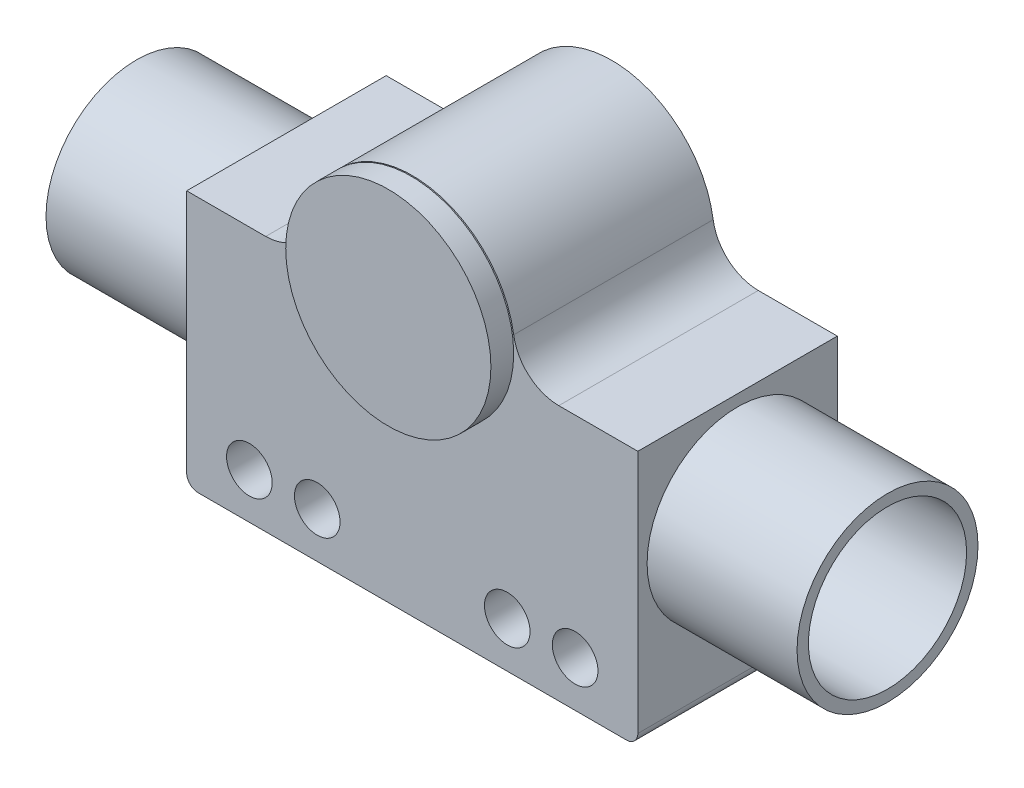
from build123d import *

# Parameters (mm, degrees)
SKETCH2_R               = 15.875
SKETCH2_R_2             = 13.875
BOSS_EXTRUDE1_DEPTH     = 65.88125
SKETCH3_R               = 4
BOSS_EXTRUDE2_DEPTH     = 17.5
CUT_EXTRUDE1_DEPTH      = 80.035366144
CUT_EXTRUDE1_DEPTH_BACK = 80.035366144
SKETCH2_3_R             = 13.875
CUT_EXTRUDE2_DEPTH      = 80.035366144
CUT_EXTRUDE2_DEPTH_BACK = 80.035366144
SKETCH3_3_R             = 4
FILLET1_R               = 2
BOSS_EXTRUDE3_START     = 0.2
SKETCH4_R               = 18
BOSS_EXTRUDE3_DEPTH     = 4
SKETCH5_R               = 7.9375
BOSS_EXTRUDE4_DEPTH     = 40
CHAMFER1_SIZE           = 1
CUT_EXTRUDE3_START      = -25
CUT_EXTRUDE3_DEPTH      = 25
SKETCH8_R               = 10
CUT_EXTRUDE4_DEPTH      = 34


# Read off the part's stored shape, not the designer's step: Split1
with BuildPart() as part:
    # Sketch2 → Boss-Extrude1 (new, symmetric)
    # profile 1 of 2: a face of its own
    with BuildSketch(Plane(origin=(0, 0, 0), x_dir=(0, 0, -1), z_dir=(1, 0, 0))):
        Circle(SKETCH2_R)
        Circle(SKETCH2_R_2, mode=Mode.SUBTRACT)
    # profile 2 of 2: a face of its own
    with BuildSketch(Plane(origin=(0, 0, 0), x_dir=(0, 0, -1), z_dir=(1, 0, 0))):
        Circle(SKETCH2_R_2)
    extrude(amount=BOSS_EXTRUDE1_DEPTH, both=True)

    # Sketch3 → Boss-Extrude2 (add, symmetric)
    # profile 1 of 6: a face of its own
    with BuildSketch(Plane.XY):
        with BuildLine():
            Line((0, -27), (0, 40))
            ThreePointArc((0, 40), (-11.74119965, 35.643468429), (-17.798965194, 24.682692308))
            ThreePointArc((-17.798965194, 24.682692308), (-20.491305436, 19.811236254), (-25.709616392, 17.875))
            Line((-25.709616392, 17.875), (-39.575, 17.875))
            Line((-39.575, 17.875), (-39.575, -27))
            Line((-39.575, -27), (0, -27))
        make_face()
        with Locations((-28.575, -19)):
            Circle(SKETCH3_R, mode=Mode.SUBTRACT)
        with Locations((-16.66875, -19)):
            Circle(SKETCH3_R, mode=Mode.SUBTRACT)
    # profile 2 of 6: a face of its own
    with BuildSketch(Plane.XY):
        with Locations((-28.575, -19)):
            Circle(SKETCH3_R)
    # profile 3 of 6: a face of its own
    with BuildSketch(Plane.XY):
        with Locations((-16.66875, -19)):
            Circle(SKETCH3_R)
    # profile 4 of 6: a face of its own
    with BuildSketch(Plane.XY):
        with BuildLine():
            ThreePointArc((17.798965194, 24.682692308), (11.74119965, 35.643468429), (0, 40))
            Line((0, 40), (0, -27))
            Line((0, -27), (39.575, -27))
            Line((39.575, -27), (39.575, 17.875))
            Line((39.575, 17.875), (25.709616392, 17.875))
            ThreePointArc((25.709616392, 17.875), (20.491305436, 19.811236254), (17.798965194, 24.682692308))
        make_face()
        with Locations((16.66875, -19)):
            Circle(SKETCH3_R, mode=Mode.SUBTRACT)
        with Locations((28.575, -19)):
            Circle(SKETCH3_R, mode=Mode.SUBTRACT)
    # profile 5 of 6: a face of its own
    with BuildSketch(Plane.XY):
        with Locations((28.575, -19)):
            Circle(SKETCH3_R)
    # profile 6 of 6: a face of its own
    with BuildSketch(Plane.XY):
        with Locations((16.66875, -19)):
            Circle(SKETCH3_R)
    extrude(amount=BOSS_EXTRUDE2_DEPTH, both=True)

    # Sketch2<3> → Cut-Extrude1 (cut, two sides: drawn at the far end of the back side and taken through both)
    with BuildSketch(Plane(origin=(0, 0, 0), x_dir=(0, 0, -1), z_dir=(1, 0, 0)).offset(-CUT_EXTRUDE1_DEPTH_BACK)):
        Circle(SKETCH2_3_R)
    extrude(amount=CUT_EXTRUDE1_DEPTH + CUT_EXTRUDE1_DEPTH_BACK, mode=Mode.SUBTRACT)

    # Sketch3<3> → Cut-Extrude2 (cut, two sides: drawn at the far end of the back side and taken through both)
    with BuildSketch(Plane.XY.offset(-CUT_EXTRUDE2_DEPTH_BACK)):
        with Locations((16.66875, -19)):
            Circle(SKETCH3_3_R)
        with Locations((28.575, -19)):
            Circle(SKETCH3_3_R)
        with Locations(Location((-28.575, -19, 0), (0, 0, 180))):
            Circle(SKETCH3_3_R)
        with Locations(Location((-16.66875, -19, 0), (0, 0, 180))):
            Circle(SKETCH3_3_R)
    extrude(amount=CUT_EXTRUDE2_DEPTH + CUT_EXTRUDE2_DEPTH_BACK, mode=Mode.SUBTRACT)

    # Fillet1
    fillet1_edges = [part.edges().sort_by_distance(p)[0] for p in [
        (39.575, -27, 0),
        (-39.575, -27, 0),
    ]]
    fillet(fillet1_edges, radius=FILLET1_R)

    # Sketch5 → Boss-Extrude4 (add)
    with BuildSketch(Plane(origin=(0, 0, -17.5), x_dir=(-1, 0, 0), z_dir=(0, 0, -1))):
        with Locations(Location((0, 22, 0), (0, 0, 180))):
            Circle(SKETCH5_R)
    extrude(amount=BOSS_EXTRUDE4_DEPTH)

    # Chamfer1
    chamfer1_edges = [part.edges().sort_by_distance(p)[0] for p in [
        (-7.9375, 22, -57.5),
    ]]
    chamfer(chamfer1_edges, length=CHAMFER1_SIZE)

    # Sketch6 → Cut-Revolve1 (revolve, cut)
    with BuildSketch(Plane(origin=(0, 0, 0), x_dir=(0, 0, -1), z_dir=(1, 0, 0)), mode=Mode.PRIVATE) as cut_revolve1_sk:
        with BuildLine():
            Line((49.5, 29.9375), (45.027864045, 29.9375))
            ThreePointArc((45.027864045, 29.9375), (47.263932023, 28.9375), (49.5, 29.9375))
        make_face()
    revolve(cut_revolve1_sk.sketch.rotate(Axis((0, 22, -57.5), (0, 0, 1)), 90), axis=Axis((0, 22, -57.5), (0, 0, 1)), mode=Mode.SUBTRACT)

    # Sketch7 → Cut-Extrude3 (cut)
    with BuildSketch(Plane(origin=(0, 0, -57.5), x_dir=(-1, 0, 0), z_dir=(0, 0, -1)).offset(CUT_EXTRUDE3_START)):
        with BuildLine():
            Line((0, 29.4375), (0.4, 29.927414853))
            ThreePointArc((0.4, 29.927414853), (0, 29.9375), (-0.4, 29.927414853))
            Line((-0.4, 29.927414853), (0, 29.4375))
        make_face()
        with BuildLine():
            Line((1.291508321, 29.324507663), (1.770504244, 29.737520337))
            ThreePointArc((1.770504244, 29.737520337), (1.37833241, 29.81691154), (0.982658042, 29.87643888))
            Line((0.982658042, 29.87643888), (1.291508321, 29.324507663))
        make_face()
        with BuildLine():
            Line((2.543774816, 28.988963867), (3.087212613, 29.312525182))
            ThreePointArc((3.087212613, 29.312525182), (2.714784888, 29.458810177), (2.335458516, 29.586141297))
            Line((2.335458516, 29.586141297), (2.543774816, 28.988963867))
        make_face()
        with BuildLine():
            Line((3.71875, 28.441063941), (4.310117588, 28.665342649))
            ThreePointArc((4.310117588, 28.665342649), (3.96875, 28.874076643), (3.617297265, 29.065342649))
            Line((3.617297265, 29.065342649), (3.71875, 28.441063941))
        make_face()
        with BuildLine():
            Line((4.780732847, 27.697455546), (5.402061822, 27.815637052))
            ThreePointArc((5.402061822, 27.815637052), (5.102126652, 28.080477767), (4.789226267, 28.32986714))
            Line((4.789226267, 28.32986714), (4.780732847, 27.697455546))
        make_face()
        with BuildLine():
            Line((5.697455546, 26.780732847), (6.32986714, 26.789226267))
            ThreePointArc((6.32986714, 26.789226267), (6.080477767, 27.102126652), (5.815637052, 27.402061822))
            Line((5.815637052, 27.402061822), (5.697455546, 26.780732847))
        make_face()
        with BuildLine():
            Line((6.441063941, 25.71875), (7.065342649, 25.617297265))
            ThreePointArc((7.065342649, 25.617297265), (6.874076643, 25.96875), (6.665342649, 26.310117588))
            Line((6.665342649, 26.310117588), (6.441063941, 25.71875))
        make_face()
        with BuildLine():
            Line((6.988963867, 24.543774816), (7.586141297, 24.335458516))
            ThreePointArc((7.586141297, 24.335458516), (7.458810177, 24.714784888), (7.312525182, 25.087212613))
            Line((7.312525182, 25.087212613), (6.988963867, 24.543774816))
        make_face()
        with BuildLine():
            Line((7.324507663, 23.291508321), (7.87643888, 22.982658042))
            ThreePointArc((7.87643888, 22.982658042), (7.81691154, 23.37833241), (7.737520337, 23.770504244))
            Line((7.737520337, 23.770504244), (7.324507663, 23.291508321))
        make_face()
        with BuildLine():
            Line((7.4375, 22), (7.927414853, 21.6))
            ThreePointArc((7.927414853, 21.6), (7.9375, 22), (7.927414853, 22.4))
            Line((7.927414853, 22.4), (7.4375, 22))
        make_face()
        with BuildLine():
            Line((7.324507663, 20.708491679), (7.737520337, 20.229495756))
            ThreePointArc((7.737520337, 20.229495756), (7.81691154, 20.62166759), (7.87643888, 21.017341958))
            Line((7.87643888, 21.017341958), (7.324507663, 20.708491679))
        make_face()
        with BuildLine():
            Line((6.988963867, 19.456225184), (7.312525182, 18.912787387))
            ThreePointArc((7.312525182, 18.912787387), (7.458810177, 19.285215112), (7.586141297, 19.664541484))
            Line((7.586141297, 19.664541484), (6.988963867, 19.456225184))
        make_face()
        with BuildLine():
            Line((6.441063941, 18.28125), (6.665342649, 17.689882412))
            ThreePointArc((6.665342649, 17.689882412), (6.874076643, 18.03125), (7.065342649, 18.382702735))
            Line((7.065342649, 18.382702735), (6.441063941, 18.28125))
        make_face()
        with BuildLine():
            Line((5.697455546, 17.219267153), (5.815637052, 16.597938178))
            ThreePointArc((5.815637052, 16.597938178), (6.080477767, 16.897873348), (6.32986714, 17.210773733))
            Line((6.32986714, 17.210773733), (5.697455546, 17.219267153))
        make_face()
        with BuildLine():
            Line((4.780732847, 16.302544454), (4.789226267, 15.67013286))
            ThreePointArc((4.789226267, 15.67013286), (5.102126652, 15.919522233), (5.402061822, 16.184362948))
            Line((5.402061822, 16.184362948), (4.780732847, 16.302544454))
        make_face()
        with BuildLine():
            Line((3.71875, 15.558936059), (3.617297265, 14.934657351))
            ThreePointArc((3.617297265, 14.934657351), (3.96875, 15.125923357), (4.310117588, 15.334657351))
            Line((4.310117588, 15.334657351), (3.71875, 15.558936059))
        make_face()
        with BuildLine():
            Line((2.543774816, 15.011036133), (2.335458516, 14.413858703))
            ThreePointArc((2.335458516, 14.413858703), (2.714784888, 14.541189823), (3.087212613, 14.687474818))
            Line((3.087212613, 14.687474818), (2.543774816, 15.011036133))
        make_face()
        with BuildLine():
            Line((1.291508321, 14.675492337), (0.982658042, 14.12356112))
            ThreePointArc((0.982658042, 14.12356112), (1.37833241, 14.18308846), (1.770504244, 14.262479663))
            Line((1.770504244, 14.262479663), (1.291508321, 14.675492337))
        make_face()
        with BuildLine():
            Line((0, 14.5625), (-0.4, 14.072585147))
            ThreePointArc((-0.4, 14.072585147), (0, 14.0625), (0.4, 14.072585147))
            Line((0.4, 14.072585147), (0, 14.5625))
        make_face()
        with BuildLine():
            Line((-1.291508321, 14.675492337), (-1.770504244, 14.262479663))
            ThreePointArc((-1.770504244, 14.262479663), (-1.37833241, 14.18308846), (-0.982658042, 14.12356112))
            Line((-0.982658042, 14.12356112), (-1.291508321, 14.675492337))
        make_face()
        with BuildLine():
            Line((-2.543774816, 15.011036133), (-3.087212613, 14.687474818))
            ThreePointArc((-3.087212613, 14.687474818), (-2.714784888, 14.541189823), (-2.335458516, 14.413858703))
            Line((-2.335458516, 14.413858703), (-2.543774816, 15.011036133))
        make_face()
        with BuildLine():
            Line((-3.71875, 15.558936059), (-4.310117588, 15.334657351))
            ThreePointArc((-4.310117588, 15.334657351), (-3.96875, 15.125923357), (-3.617297265, 14.934657351))
            Line((-3.617297265, 14.934657351), (-3.71875, 15.558936059))
        make_face()
        with BuildLine():
            Line((-4.780732847, 16.302544454), (-5.402061822, 16.184362948))
            ThreePointArc((-5.402061822, 16.184362948), (-5.102126652, 15.919522233), (-4.789226267, 15.67013286))
            Line((-4.789226267, 15.67013286), (-4.780732847, 16.302544454))
        make_face()
        with BuildLine():
            Line((-5.697455546, 17.219267153), (-6.32986714, 17.210773733))
            ThreePointArc((-6.32986714, 17.210773733), (-6.080477767, 16.897873348), (-5.815637052, 16.597938178))
            Line((-5.815637052, 16.597938178), (-5.697455546, 17.219267153))
        make_face()
        with BuildLine():
            Line((-6.441063941, 18.28125), (-7.065342649, 18.382702735))
            ThreePointArc((-7.065342649, 18.382702735), (-6.874076643, 18.03125), (-6.665342649, 17.689882412))
            Line((-6.665342649, 17.689882412), (-6.441063941, 18.28125))
        make_face()
        with BuildLine():
            Line((-6.988963867, 19.456225184), (-7.586141297, 19.664541484))
            ThreePointArc((-7.586141297, 19.664541484), (-7.458810177, 19.285215112), (-7.312525182, 18.912787387))
            Line((-7.312525182, 18.912787387), (-6.988963867, 19.456225184))
        make_face()
        with BuildLine():
            Line((-7.324507663, 20.708491679), (-7.87643888, 21.017341958))
            ThreePointArc((-7.87643888, 21.017341958), (-7.81691154, 20.62166759), (-7.737520337, 20.229495756))
            Line((-7.737520337, 20.229495756), (-7.324507663, 20.708491679))
        make_face()
        with BuildLine():
            Line((-7.4375, 22), (-7.927414853, 22.4))
            ThreePointArc((-7.927414853, 22.4), (-7.9375, 22), (-7.927414853, 21.6))
            Line((-7.927414853, 21.6), (-7.4375, 22))
        make_face()
        with BuildLine():
            Line((-7.324507663, 23.291508321), (-7.737520337, 23.770504244))
            ThreePointArc((-7.737520337, 23.770504244), (-7.81691154, 23.37833241), (-7.87643888, 22.982658042))
            Line((-7.87643888, 22.982658042), (-7.324507663, 23.291508321))
        make_face()
        with BuildLine():
            Line((-6.988963867, 24.543774816), (-7.312525182, 25.087212613))
            ThreePointArc((-7.312525182, 25.087212613), (-7.458810177, 24.714784888), (-7.586141297, 24.335458516))
            Line((-7.586141297, 24.335458516), (-6.988963867, 24.543774816))
        make_face()
        with BuildLine():
            Line((-6.441063941, 25.71875), (-6.665342649, 26.310117588))
            ThreePointArc((-6.665342649, 26.310117588), (-6.874076643, 25.96875), (-7.065342649, 25.617297265))
            Line((-7.065342649, 25.617297265), (-6.441063941, 25.71875))
        make_face()
        with BuildLine():
            Line((-5.697455546, 26.780732847), (-5.815637052, 27.402061822))
            ThreePointArc((-5.815637052, 27.402061822), (-6.080477767, 27.102126652), (-6.32986714, 26.789226267))
            Line((-6.32986714, 26.789226267), (-5.697455546, 26.780732847))
        make_face()
        with BuildLine():
            Line((-4.780732847, 27.697455546), (-4.789226267, 28.32986714))
            ThreePointArc((-4.789226267, 28.32986714), (-5.102126652, 28.080477767), (-5.402061822, 27.815637052))
            Line((-5.402061822, 27.815637052), (-4.780732847, 27.697455546))
        make_face()
        with BuildLine():
            Line((-3.71875, 28.441063941), (-3.617297265, 29.065342649))
            ThreePointArc((-3.617297265, 29.065342649), (-3.96875, 28.874076643), (-4.310117588, 28.665342649))
            Line((-4.310117588, 28.665342649), (-3.71875, 28.441063941))
        make_face()
        with BuildLine():
            Line((-2.543774816, 28.988963867), (-2.335458516, 29.586141297))
            ThreePointArc((-2.335458516, 29.586141297), (-2.714784888, 29.458810177), (-3.087212613, 29.312525182))
            Line((-3.087212613, 29.312525182), (-2.543774816, 28.988963867))
        make_face()
        with BuildLine():
            Line((-1.291508321, 29.324507663), (-0.982658042, 29.87643888))
            ThreePointArc((-0.982658042, 29.87643888), (-1.37833241, 29.81691154), (-1.770504244, 29.737520337))
            Line((-1.770504244, 29.737520337), (-1.291508321, 29.324507663))
        make_face()
    extrude(amount=CUT_EXTRUDE3_DEPTH, mode=Mode.SUBTRACT)


with BuildPart() as body_2:
    # Sketch4 → Boss-Extrude3 (new body)
    with BuildSketch(Plane.XY.offset(17.5).offset(BOSS_EXTRUDE3_START)):
        with Locations((0, 22)):
            Circle(SKETCH4_R)
    extrude(amount=BOSS_EXTRUDE3_DEPTH)


with BuildPart() as body_3:
    # Split1: the piece on the far side of the plane
    add(part.part)
    split(bisect_by=Plane.XY.offset(-17.5), keep=Keep.BOTTOM)


with BuildPart() as part_1:
    add(part.part)

    # Split1
    split(bisect_by=Plane.XY.offset(-17.5), keep=Keep.TOP)

    # Sketch8 → Cut-Extrude4 (cut)
    with BuildSketch(Plane(origin=(0, 0, -17.5), x_dir=(-1, 0, 0), z_dir=(0, 0, -1))):
        with Locations((0, 22)):
            Circle(SKETCH8_R)
    extrude(amount=-CUT_EXTRUDE4_DEPTH, mode=Mode.SUBTRACT)


solid = Compound([body_2.part, part_1.part])
